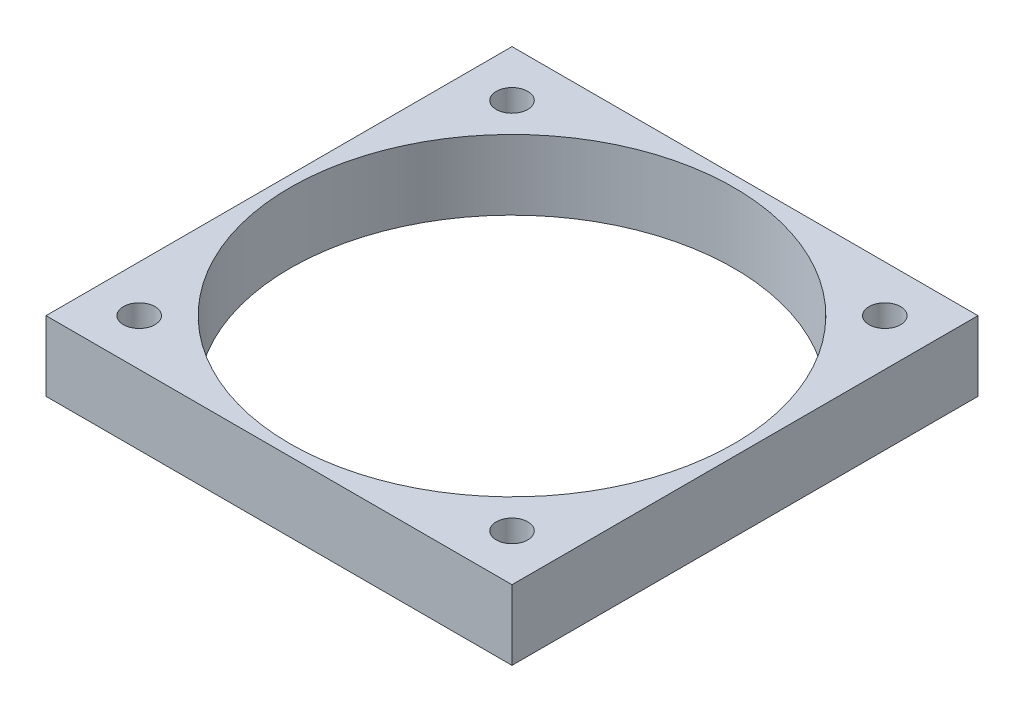
from build123d import *

# Parameters (mm, degrees)
SKETCH1_W           = 40
SKETCH1_H           = 40
SKETCH1_R           = 1.35255
SKETCH1_R_2         = 19.05
BOSS_EXTRUDE1_DEPTH = 6


with BuildPart() as part:
    # Sketch1 → Boss-Extrude1 (new body)
    with BuildSketch(Plane(origin=(0, 0, 0), x_dir=(1, 0, 0), z_dir=(0, 1, 0))):
        with Locations((20, 20)):
            Rectangle(SKETCH1_W, SKETCH1_H)
        with Locations((4, 36)):
            Circle(SKETCH1_R, mode=Mode.SUBTRACT)
        with Locations((36, 36)):
            Circle(SKETCH1_R, mode=Mode.SUBTRACT)
        with Locations((4, 4)):
            Circle(SKETCH1_R, mode=Mode.SUBTRACT)
        with Locations((36, 4)):
            Circle(SKETCH1_R, mode=Mode.SUBTRACT)
        with Locations((20, 20)):
            Circle(SKETCH1_R_2, mode=Mode.SUBTRACT)
    extrude(amount=BOSS_EXTRUDE1_DEPTH)


solid = part.part
